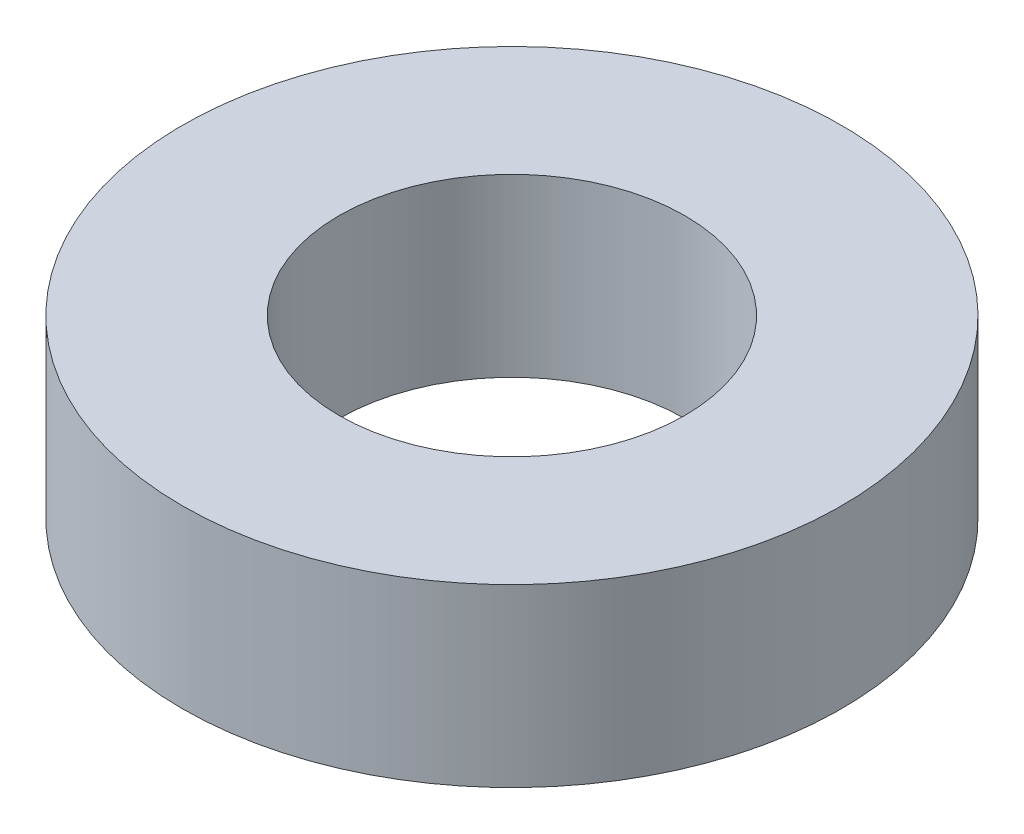
from build123d import *

# Parameters (mm, degrees)
SKETCH1_R           = 4.7625
SKETCH1_R_2         = 2.499999953
BOSS_EXTRUDE1_DEPTH = 2.54


with BuildPart() as part:
    # Sketch1 → Boss-Extrude1 (new body)
    with BuildSketch(Plane(origin=(0, 0, 0), x_dir=(1, 0, 0), z_dir=(0, 1, 0))):
        Circle(SKETCH1_R)
        Circle(SKETCH1_R_2, mode=Mode.SUBTRACT)
    extrude(amount=BOSS_EXTRUDE1_DEPTH)


solid = part.part
